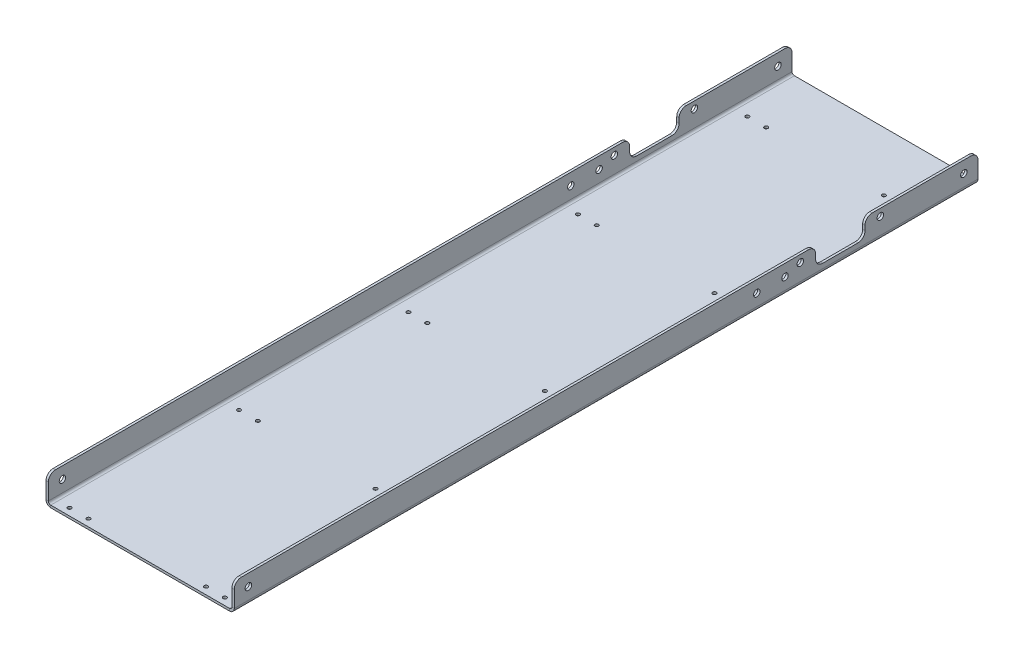
from build123d import *

# Parameters (mm, degrees)
SKETCH1_W                                 = 254
SKETCH1_H                                 = 1003.3
BASE_FLANGE1_DEPTH                        = 3.175
EDGE_FLANGE1_STRIP_W                      = 19.05
EDGE_FLANGE1_STRIP_H                      = 3.175
EDGE_FLANGE1_STRIP_CUT_DEPTH              = 1003.3
EDGE_FLANGE1_STRIP_2_W                    = 19.05
EDGE_FLANGE1_STRIP_2_H                    = 3.175
EDGE_FLANGE1_STRIP_CUT_2_DEPTH            = 1003.3
EDGE_FLANGE1_DEPTH                        = 1003.3
EDGE_FLANGE1_BEND_DEPTH                   = 1003.3
SKETCH30_W                                = 66.675
SKETCH30_H                                = 25.4
CUT_EXTRUDE4_DEPTH                        = 1036.541716024
HOLE_FOR_1_4_SELF_CLINCHING_NUTS_S_SS_C_D = 8.7376
F_10_0_1935_DIAMETER_HOLE1_D              = 4.9149
FILLET5_R                                 = 9.525


# Sheet-metal steps are written as plain solids
with BuildPart() as part:
    # Sketch1 → Base-Flange1 (new body)
    with BuildSketch(Plane(origin=(0, 0, 0), x_dir=(1, 0, 0), z_dir=(0, 1, 0))):
        with Locations((0, -501.65)):
            Rectangle(SKETCH1_W, SKETCH1_H)
    extrude(amount=-BASE_FLANGE1_DEPTH)

    # Edge-Flange1 strip (across the edge) → Edge-Flange1 strip cut (cut)
    with BuildSketch(Plane(origin=(-127, 0, 0), x_dir=(1, 0, 0), z_dir=(0, 0, 1))):
        with Locations((-3.175, -1.5875)):
            Rectangle(EDGE_FLANGE1_STRIP_W, EDGE_FLANGE1_STRIP_H)
    extrude(amount=EDGE_FLANGE1_STRIP_CUT_DEPTH, mode=Mode.SUBTRACT)

    # Edge-Flange1 strip 2 (across the edge) → Edge-Flange1 strip cut 2 (cut)
    with BuildSketch(Plane(origin=(127, 0, 1003.3), x_dir=(-1, 0, 0), z_dir=(0, 0, -1))):
        with Locations((-3.175, -1.5875)):
            Rectangle(EDGE_FLANGE1_STRIP_2_W, EDGE_FLANGE1_STRIP_2_H)
    extrude(amount=EDGE_FLANGE1_STRIP_CUT_2_DEPTH, mode=Mode.SUBTRACT)

    # Edge-Flange1 section (across the edge) → Edge-Flange1 (add)
    with BuildSketch(Plane(origin=(-127, 0, 0), x_dir=(1, 0, 0), z_dir=(0, 0, 1))):
        with BuildLine():
            Line((0, 3.175), (0, 34.925))
            Line((0, 34.925), (3.175, 34.925))
            Line((3.175, 34.925), (3.175, 3.175))
            ThreePointArc((3.175, 3.175), (4.10493597, 0.92993597), (6.35, 0))
            Line((6.35, 0), (6.35, -3.175))
            ThreePointArc((6.35, -3.175), (1.859871939, -1.315128061), (0, 3.175))
        make_face()
    extrude(amount=EDGE_FLANGE1_DEPTH)

    # Edge-Flange1 section 2 (across the edge) → Edge-Flange1 bend (add)
    with BuildSketch(Plane(origin=(127, 0, 1003.3), x_dir=(-1, 0, 0), z_dir=(0, 0, -1))):
        with BuildLine():
            Line((0, 3.175), (0, 34.925))
            Line((0, 34.925), (3.175, 34.925))
            Line((3.175, 34.925), (3.175, 3.175))
            ThreePointArc((3.175, 3.175), (4.10493597, 0.92993597), (6.35, 0))
            Line((6.35, 0), (6.35, -3.175))
            ThreePointArc((6.35, -3.175), (1.859871939, -1.315128061), (0, 3.175))
        make_face()
    extrude(amount=EDGE_FLANGE1_BEND_DEPTH)

    # Sketch30 → Cut-Extrude4 (cut, through all)
    with BuildSketch(Plane.ZY.offset(127)):
        with Locations((185.7375, 22.225)):
            Rectangle(SKETCH30_W, SKETCH30_H)
    extrude(amount=-CUT_EXTRUDE4_DEPTH, mode=Mode.SUBTRACT)

    # Hole for 1/4 Self-clinching Nuts (S,SS,CLS,CLSS)1 (through all)
    with Locations(Plane.ZY.offset(127)):
        with Locations((19.05, 19.05), (260.35, 19.05), (298.45, 19.05), (984.25, 19.05), (239.7125, 25.4), (131.7625, 25.4)):
            Hole(HOLE_FOR_1_4_SELF_CLINCHING_NUTS_S_SS_C_D / 2)

    # #10 (0.1935) Diameter Hole1 (through all)
    with Locations(Plane(origin=(0, 0, 0), x_dir=(1, 0, 0), z_dir=(0, 1, 0))):
        with Locations((104.775, -79.375), (79.375, -79.375), (-79.375, -79.375), (-104.775, -79.375), (-104.775, -307.975), (-79.375, -307.975), (79.375, -307.975), (104.775, -307.975), (104.775, -536.575), (79.375, -536.575), (-79.375, -765.175), (-79.375, -536.575), (-104.775, -536.575), (-104.775, -765.175), (79.375, -765.175), (104.775, -765.175), (104.775, -993.775), (79.375, -993.775), (-79.375, -993.775), (-104.775, -993.775)):
            Hole(F_10_0_1935_DIAMETER_HOLE1_D / 2)

    # Fillet5
    fillet5_edges = [part.edges().sort_by_distance(p)[0] for p in [
        (-125.4125, 34.925, 0),
        (-125.4125, 34.925, 1003.3),
        (125.4125, 34.925, 1003.3),
        (125.4125, 34.925, 0),
        (-125.4125, 34.925, 152.4),
        (-125.4125, 9.525, 219.075),
        (-125.4125, 9.525, 152.4),
        (-125.4125, 34.925, 219.075),
        (125.4125, 9.525, 152.4),
        (125.4125, 34.925, 152.4),
        (125.4125, 34.925, 219.075),
        (125.4125, 9.525, 219.075),
    ]]
    fillet(fillet5_edges, radius=FILLET5_R)


solid = part.part
